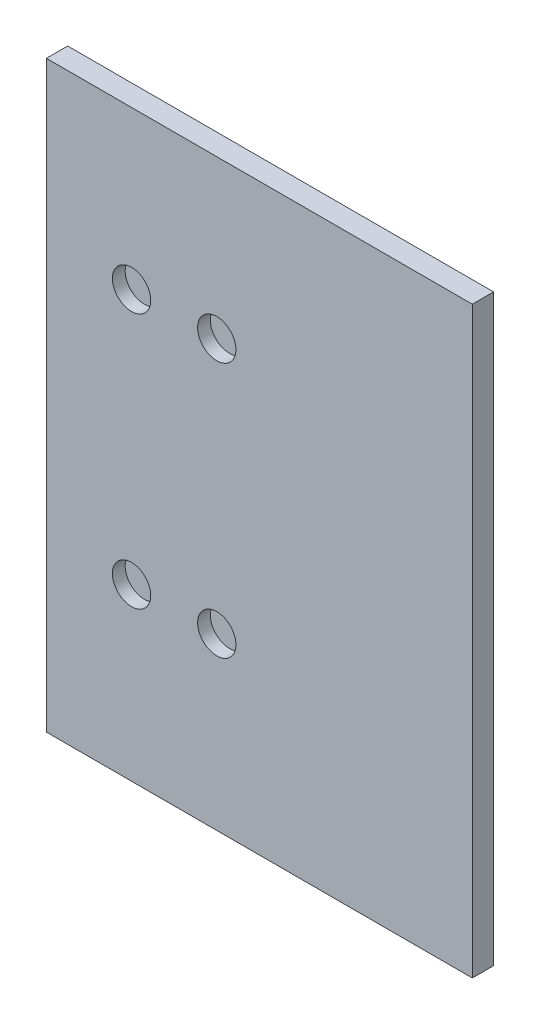
from build123d import *

# Parameters (mm, degrees)
BOSS_EXTRUDE1_DEPTH = 6.35
SKETCH3_R           = 5.715
CUT_EXTRUDE1_DEPTH  = 3.81
SKETCH2_R           = 5.715
CUT_EXTRUDE2_DEPTH  = 3.81


with BuildPart() as part:
    # Sketch1 → Boss-Extrude1 (new body)
    with BuildSketch(Plane.XY):
        Polygon((0, 173.99), (63.5, 173.99), (63.5, 0), (-63.5, 0), (-63.5, 173.99), align=None)
    extrude(amount=BOSS_EXTRUDE1_DEPTH)

    # Sketch3 → Cut-Extrude1 (cut)
    with BuildSketch(Plane.XY.offset(6.35)):
        with Locations((-38.1, 127)):
            Circle(SKETCH3_R)
        with Locations((-12.7, 127)):
            Circle(SKETCH3_R)
        with Locations((-38.1, 50.8)):
            Circle(SKETCH3_R)
        with Locations((-12.7, 50.8)):
            Circle(SKETCH3_R)
    extrude(amount=-CUT_EXTRUDE1_DEPTH, mode=Mode.SUBTRACT)

    # Sketch2 → Cut-Extrude2 (cut)
    with BuildSketch(Plane(origin=(0, 0, 0), x_dir=(-1, 0, 0), z_dir=(0, 0, -1))):
        with Locations((-48.26, 134.62)):
            Circle(SKETCH2_R)
        with Locations((-7.62, 134.62)):
            Circle(SKETCH2_R)
        with Locations((-48.26, 50.8)):
            Circle(SKETCH2_R)
        with Locations((-7.62, 50.8)):
            Circle(SKETCH2_R)
    extrude(amount=-CUT_EXTRUDE2_DEPTH, mode=Mode.SUBTRACT)


solid = part.part
